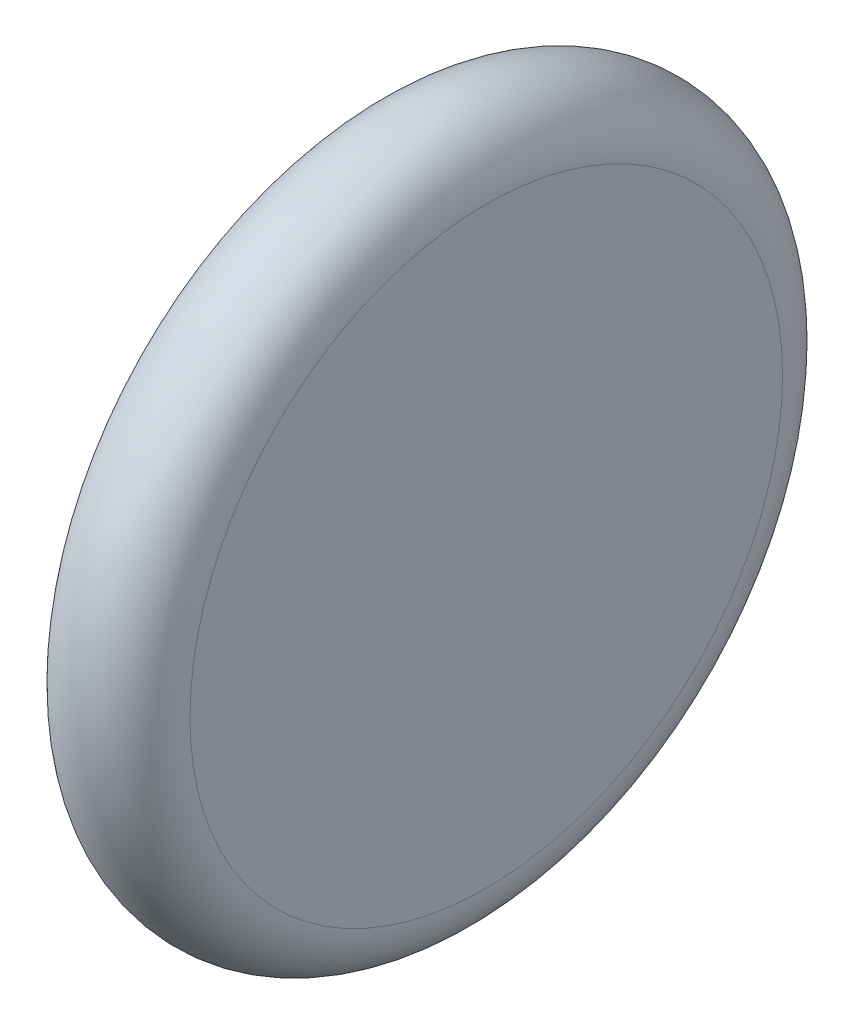
from build123d import *

# Parameters (mm, degrees)
FILLET1_R = 5


with BuildPart() as part:
    # Sketch1 → Revolve2 (revolve)
    with BuildSketch(Plane.XY, mode=Mode.PRIVATE) as revolve2_sk:
        Polygon((0, 0), (0, 5), (10, 5), (10, 25), (7, 25), (7, 30), (17, 30), (17, 0), align=None)
    revolve(revolve2_sk.sketch.rotate(Axis((0, 0, 0), (1, 0, 0)), 90), axis=Axis((0, 0, 0), (1, 0, 0)))

    # Fillet1
    fillet1_edges = [part.edges().sort_by_distance(p)[0] for p in [
        (7, 0, -30),
        (17, 0, -30),
    ]]
    fillet(fillet1_edges, radius=FILLET1_R - 0.0001)  # a hair under: the kernel refuses the full size


solid = part.part
